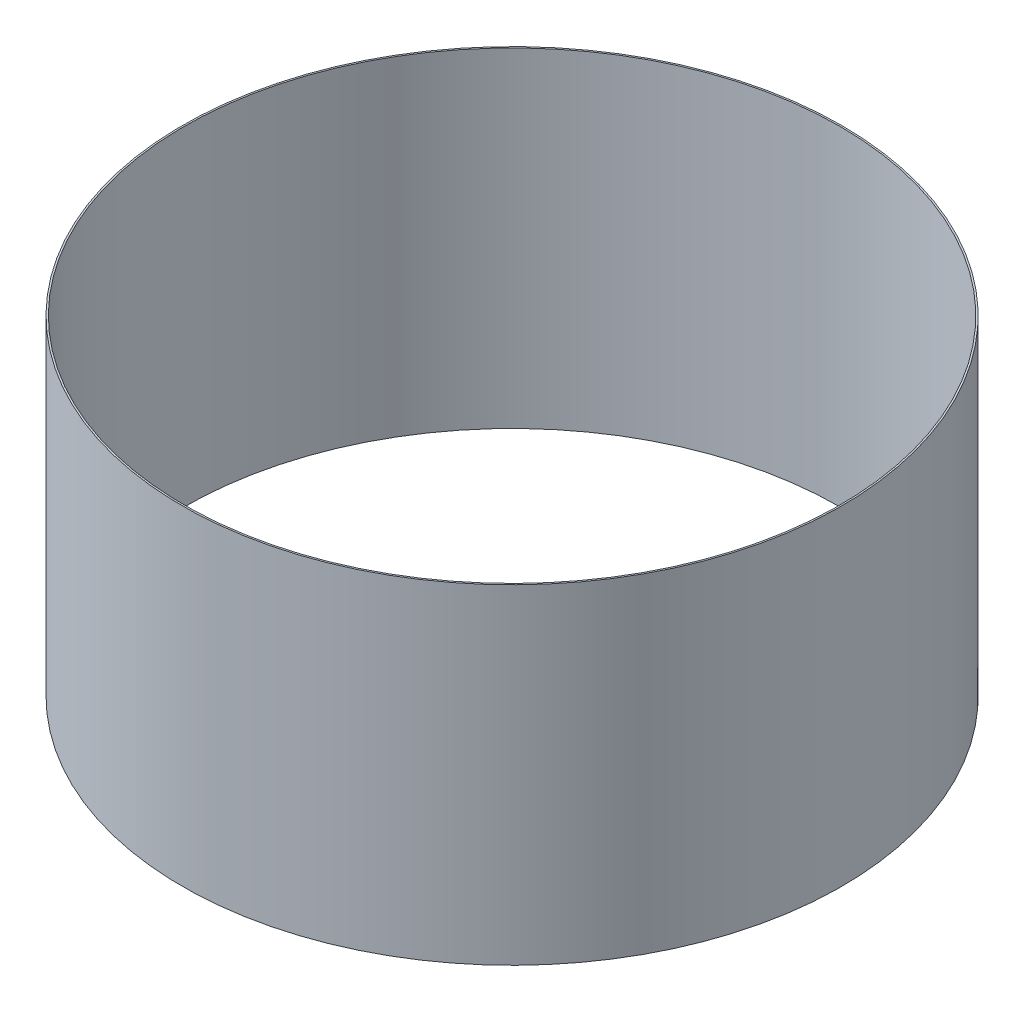
from build123d import *

# Parameters (mm, degrees)
BASE_FLANGE1_DEPTH                    = 200
BASE_FLANGE2_START                    = -1.5
BASE_FLANGE2_DEPTH                    = 1.5
SKETCH9_W                             = 6.25
SKETCH9_H                             = 1.5
F_12_5_12_5_DIAMETER_HOLE2_AT_2_COUNT = 2
F_12_5_12_5_DIAMETER_HOLE2_AT_2_PITCH = 250
F_12_5_12_5_DIAMETER_HOLE2_AT_3_COUNT = 2
F_12_5_12_5_DIAMETER_HOLE2_AT_3_PITCH = 125
F_12_5_12_5_DIAMETER_HOLE2_AT_4_COUNT = 2
F_12_5_12_5_DIAMETER_HOLE2_AT_4_PITCH = 465.111814513
F_12_5_12_5_DIAMETER_HOLE2_AT_5_COUNT = 2
F_12_5_12_5_DIAMETER_HOLE2_AT_5_PITCH = 513.034111926
F_12_5_12_5_DIAMETER_HOLE2_AT_6_COUNT = 2
F_12_5_12_5_DIAMETER_HOLE2_AT_6_PITCH = 448
SKETCH11_W                            = 6.25
SKETCH11_H                            = 1.5
F_12_5_12_5_DIAMETER_HOLE3_AT_2_COUNT = 2
F_12_5_12_5_DIAMETER_HOLE3_AT_2_PITCH = 332
CRVPATTERN1_COUNT                     = 4
CRVPATTERN1_PITCH                     = 125
CRVPATTERN1_COPY_1_SKETCH_W           = 6.25
CRVPATTERN1_COPY_1_SKETCH_H           = 1.5
CRVPATTERN1_COPY_2_SKETCH_W           = 6.25
CRVPATTERN1_COPY_2_SKETCH_H           = 1.5
CRVPATTERN1_COPY_3_SKETCH_W           = 6.25
CRVPATTERN1_COPY_3_SKETCH_H           = 1.5
BASE_FLANGE3_DEPTH                    = 1.5
SKETCH14_W                            = 80
SKETCH14_H                            = 6
SKETCH14_W_2                          = 50
EXTRUDE1_DEPTH                        = 10
CRVPATTERN2_START                     = -81.5
CRVPATTERN2_OUTLINE_W                 = 1.5
CRVPATTERN2_OUTLINE_H                 = 6
CRVPATTERN2_DEPTH                     = 80
CRVPATTERN2_START_2                   = -134.5
CRVPATTERN2_2_OUTLINE_W               = 1.5
CRVPATTERN2_2_OUTLINE_H               = 6
CRVPATTERN2_2_DEPTH                   = 50
SKETCH15_W                            = 6
SKETCH15_H                            = 80
SKETCH15_H_2                          = 50
SKETCH15_H_3                          = 30
SKETCH15_W_2                          = 10
SKETCH15_H_4                          = 10
EXTRUDE2_DEPTH                        = 10


# Read off the part's stored shape, not the designer's step: CrvPattern2
# Sheet-metal steps are written as plain solids
with BuildPart() as part:
    # Sketch1 → Base-Flange1 (new body)
    with BuildSketch(Plane(origin=(0, 0, 0), x_dir=(1, 0, 0), z_dir=(0, 1, 0))):
        with BuildLine():
            ThreePointArc((-0.005, 198.999999937), (0, -199), (0.005, 198.999999937))
            Line((0.005, 198.999999937), (0.005025126, 199.999999937))
            ThreePointArc((0.005025126, 199.999999937), (0, -200), (-0.005025126, 199.999999937))
            Line((-0.005025126, 199.999999937), (-0.005, 198.999999937))
        make_face()
    extrude(amount=BASE_FLANGE1_DEPTH)


with BuildPart() as body_2:
    # Sketch4 → Base-Flange2 (new body)
    with BuildSketch(Plane(origin=(0, 0, 0), x_dir=(1, 0, 0), z_dir=(0, 1, 0)).offset(BASE_FLANGE2_START)):
        Polygon((240, 180), (240, -180), (0, -220), (-240, -180), (-240, 180), (0, 220), align=None)
        with BuildLine():
            Line((143.038535018, 140), (-142.828568571, 140))
            ThreePointArc((-142.828568571, 140), (-200, 0), (-142.828568571, -140))
            Line((-142.828568571, -140), (143.038535018, -140))
            ThreePointArc((143.038535018, -140), (200.15, 0), (143.038535018, 140))
        make_face(mode=Mode.SUBTRACT)
    extrude(amount=BASE_FLANGE2_DEPTH)

    # Sketch9 → Ø12.5 (12.5) Diameter Hole2 (revolve, cut)
    with BuildSketch(Plane(origin=(-224, 0, -125), x_dir=(0, 0, 1), z_dir=(1, 0, 0))):
        with Locations((3.125, 0.75)):
            Rectangle(SKETCH9_W, SKETCH9_H)
    f_12_5_12_5_diameter_hole2 = revolve(axis=Axis((-224, 6.35, -125), (0, -1, 0)), mode=Mode.SUBTRACT)

    # Ø12.5 (12.5) Diameter Hole2 at 2: Ø12.5 (12.5) Diameter Hole2 ×2
    with Locations(*[(0, 0, i * F_12_5_12_5_DIAMETER_HOLE2_AT_2_PITCH) for i in range(1, F_12_5_12_5_DIAMETER_HOLE2_AT_2_COUNT)]):
        add(f_12_5_12_5_diameter_hole2, mode=Mode.SUBTRACT)

    # Ø12.5 (12.5) Diameter Hole2 at 3: Ø12.5 (12.5) Diameter Hole2 ×2
    with Locations(*[(0, 0, i * F_12_5_12_5_DIAMETER_HOLE2_AT_3_PITCH) for i in range(1, F_12_5_12_5_DIAMETER_HOLE2_AT_3_COUNT)]):
        add(f_12_5_12_5_diameter_hole2, mode=Mode.SUBTRACT)

    # Ø12.5 (12.5) Diameter Hole2 at 4: Ø12.5 (12.5) Diameter Hole2 ×2
    with Locations(*[Vector(0.9632092456491202, 0, 0.2687525797012055) * (i * F_12_5_12_5_DIAMETER_HOLE2_AT_4_PITCH) for i in range(1, F_12_5_12_5_DIAMETER_HOLE2_AT_4_COUNT)]):
        add(f_12_5_12_5_diameter_hole2, mode=Mode.SUBTRACT)

    # Ø12.5 (12.5) Diameter Hole2 at 5: Ø12.5 (12.5) Diameter Hole2 ×2
    with Locations(*[Vector(0.8732362811468641, 0, 0.4872970318899912) * (i * F_12_5_12_5_DIAMETER_HOLE2_AT_5_PITCH) for i in range(1, F_12_5_12_5_DIAMETER_HOLE2_AT_5_COUNT)]):
        add(f_12_5_12_5_diameter_hole2, mode=Mode.SUBTRACT)

    # Ø12.5 (12.5) Diameter Hole2 at 6: Ø12.5 (12.5) Diameter Hole2 ×2
    with Locations(*[(i * F_12_5_12_5_DIAMETER_HOLE2_AT_6_PITCH, 0, 0) for i in range(1, F_12_5_12_5_DIAMETER_HOLE2_AT_6_COUNT)]):
        add(f_12_5_12_5_diameter_hole2, mode=Mode.SUBTRACT)

    # Sketch11 → Ø12.5 (12.5) Diameter Hole3 (revolve, cut)
    with BuildSketch(Plane(origin=(-187.5, 0, -166), x_dir=(0, 0, 1), z_dir=(1, 0, 0))):
        with Locations((3.125, 0.75)):
            Rectangle(SKETCH11_W, SKETCH11_H)
    f_12_5_12_5_diameter_hole3 = revolve(axis=Axis((-187.5, 6.35, -166), (0, -1, 0)), mode=Mode.SUBTRACT)

    # Ø12.5 (12.5) Diameter Hole3 at 2: Ø12.5 (12.5) Diameter Hole3 ×2
    with Locations(*[(0, 0, i * F_12_5_12_5_DIAMETER_HOLE3_AT_2_PITCH) for i in range(1, F_12_5_12_5_DIAMETER_HOLE3_AT_2_COUNT)]):
        add(f_12_5_12_5_diameter_hole3, mode=Mode.SUBTRACT)

    # CrvPattern1: Ø12.5 (12.5) Diameter Hole3 ×4
    with Locations(*[(i * CRVPATTERN1_PITCH, 0, 0) for i in range(1, CRVPATTERN1_COUNT)]):
        add(f_12_5_12_5_diameter_hole3, mode=Mode.SUBTRACT)

    # CrvPattern1 copy 1 sketch → CrvPattern1 copy 1 (revolve, cut)
    with BuildSketch(Plane(origin=(-62.5, 0, 166), x_dir=(0, 0, 1), z_dir=(1, 0, 0))):
        with Locations((3.125, 0.75)):
            Rectangle(CRVPATTERN1_COPY_1_SKETCH_W, CRVPATTERN1_COPY_1_SKETCH_H)
    revolve(axis=Axis((-62.5, 6.35, 166), (0, -1, 0)), mode=Mode.SUBTRACT)

    # CrvPattern1 copy 2 sketch → CrvPattern1 copy 2 (revolve, cut)
    with BuildSketch(Plane(origin=(62.5, 0, 166), x_dir=(0, 0, 1), z_dir=(1, 0, 0))):
        with Locations((3.125, 0.75)):
            Rectangle(CRVPATTERN1_COPY_2_SKETCH_W, CRVPATTERN1_COPY_2_SKETCH_H)
    revolve(axis=Axis((62.5, 6.35, 166), (0, -1, 0)), mode=Mode.SUBTRACT)

    # CrvPattern1 copy 3 sketch → CrvPattern1 copy 3 (revolve, cut)
    with BuildSketch(Plane(origin=(187.5, 0, 166), x_dir=(0, 0, 1), z_dir=(1, 0, 0))):
        with Locations((3.125, 0.75)):
            Rectangle(CRVPATTERN1_COPY_3_SKETCH_W, CRVPATTERN1_COPY_3_SKETCH_H)
    revolve(axis=Axis((187.5, 6.35, 166), (0, -1, 0)), mode=Mode.SUBTRACT)

    # Sketch13 → Base-Flange3 (add)
    with BuildSketch(Plane.XZ.offset(1.5)):
        with BuildLine():
            Line((-142.828568571, -140), (143.038535018, -140))
            ThreePointArc((143.038535018, -140), (200.15, 0), (143.038535018, 140))
            Line((143.038535018, 140), (-142.828568571, 140))
            ThreePointArc((-142.828568571, 140), (-200, 0), (-142.828568571, -140))
        make_face()
    extrude(amount=-BASE_FLANGE3_DEPTH)

    # Sketch14 → Extrude1 (cut)
    with BuildSketch(Plane(origin=(0, 0, 0), x_dir=(1, 0, 0), z_dir=(0, 1, 0))):
        with Locations((-41.5, 137)):
            Rectangle(SKETCH14_W, SKETCH14_H)
        with Locations((-109.5, 137)):
            Rectangle(SKETCH14_W_2, SKETCH14_H)
    extrude1 = extrude(amount=-EXTRUDE1_DEPTH, mode=Mode.SUBTRACT)

    # CrvPattern2 outline → CrvPattern2 (cut)
    with BuildSketch(Plane.YZ.offset(CRVPATTERN2_START)):
        with Locations((-0.75, -127.866666667)):
            Rectangle(CRVPATTERN2_OUTLINE_W, CRVPATTERN2_OUTLINE_H)
        with Locations((-0.75, -118.733333333)):
            Rectangle(CRVPATTERN2_OUTLINE_W, CRVPATTERN2_OUTLINE_H)
        with Locations((-0.75, -109.6)):
            Rectangle(CRVPATTERN2_OUTLINE_W, CRVPATTERN2_OUTLINE_H)
        with Locations((-0.75, -100.466666667)):
            Rectangle(CRVPATTERN2_OUTLINE_W, CRVPATTERN2_OUTLINE_H)
        with Locations((-0.75, -91.333333333)):
            Rectangle(CRVPATTERN2_OUTLINE_W, CRVPATTERN2_OUTLINE_H)
        with Locations((-0.75, -82.2)):
            Rectangle(CRVPATTERN2_OUTLINE_W, CRVPATTERN2_OUTLINE_H)
        with Locations((-0.75, -73.066666667)):
            Rectangle(CRVPATTERN2_OUTLINE_W, CRVPATTERN2_OUTLINE_H)
        with Locations((-0.75, -63.933333333)):
            Rectangle(CRVPATTERN2_OUTLINE_W, CRVPATTERN2_OUTLINE_H)
        with Locations((-0.75, -54.8)):
            Rectangle(CRVPATTERN2_OUTLINE_W, CRVPATTERN2_OUTLINE_H)
        with Locations((-0.75, -45.666666667)):
            Rectangle(CRVPATTERN2_OUTLINE_W, CRVPATTERN2_OUTLINE_H)
        with Locations((-0.75, -36.533333333)):
            Rectangle(CRVPATTERN2_OUTLINE_W, CRVPATTERN2_OUTLINE_H)
        with Locations((-0.75, -27.4)):
            Rectangle(CRVPATTERN2_OUTLINE_W, CRVPATTERN2_OUTLINE_H)
        with Locations((-0.75, -18.266666667)):
            Rectangle(CRVPATTERN2_OUTLINE_W, CRVPATTERN2_OUTLINE_H)
        with Locations((-0.75, -9.133333333)):
            Rectangle(CRVPATTERN2_OUTLINE_W, CRVPATTERN2_OUTLINE_H)
        with Locations((-0.75, 0)):
            Rectangle(CRVPATTERN2_OUTLINE_W, CRVPATTERN2_OUTLINE_H)
        with Locations((-0.75, 9.133333333)):
            Rectangle(CRVPATTERN2_OUTLINE_W, CRVPATTERN2_OUTLINE_H)
        with Locations((-0.75, 18.266666667)):
            Rectangle(CRVPATTERN2_OUTLINE_W, CRVPATTERN2_OUTLINE_H)
        with Locations((-0.75, 27.4)):
            Rectangle(CRVPATTERN2_OUTLINE_W, CRVPATTERN2_OUTLINE_H)
        with Locations((-0.75, 36.533333333)):
            Rectangle(CRVPATTERN2_OUTLINE_W, CRVPATTERN2_OUTLINE_H)
        with Locations((-0.75, 45.666666667)):
            Rectangle(CRVPATTERN2_OUTLINE_W, CRVPATTERN2_OUTLINE_H)
        with Locations((-0.75, 54.8)):
            Rectangle(CRVPATTERN2_OUTLINE_W, CRVPATTERN2_OUTLINE_H)
        with Locations((-0.75, 63.933333333)):
            Rectangle(CRVPATTERN2_OUTLINE_W, CRVPATTERN2_OUTLINE_H)
        with Locations((-0.75, 73.066666667)):
            Rectangle(CRVPATTERN2_OUTLINE_W, CRVPATTERN2_OUTLINE_H)
        with Locations((-0.75, 82.2)):
            Rectangle(CRVPATTERN2_OUTLINE_W, CRVPATTERN2_OUTLINE_H)
        with Locations((-0.75, 91.333333333)):
            Rectangle(CRVPATTERN2_OUTLINE_W, CRVPATTERN2_OUTLINE_H)
        with Locations((-0.75, 100.466666667)):
            Rectangle(CRVPATTERN2_OUTLINE_W, CRVPATTERN2_OUTLINE_H)
        with Locations((-0.75, 109.6)):
            Rectangle(CRVPATTERN2_OUTLINE_W, CRVPATTERN2_OUTLINE_H)
        with Locations((-0.75, 118.733333333)):
            Rectangle(CRVPATTERN2_OUTLINE_W, CRVPATTERN2_OUTLINE_H)
        with Locations((-0.75, 127.866666667)):
            Rectangle(CRVPATTERN2_OUTLINE_W, CRVPATTERN2_OUTLINE_H)
        with Locations((-0.75, 137)):
            Rectangle(CRVPATTERN2_OUTLINE_W, CRVPATTERN2_OUTLINE_H)
    crvpattern2 = extrude(amount=CRVPATTERN2_DEPTH, mode=Mode.SUBTRACT)

    # CrvPattern2 2 outline → CrvPattern2 2 (cut)
    with BuildSketch(Plane.YZ.offset(CRVPATTERN2_START_2)):
        with Locations((-0.75, -127.866666667)):
            Rectangle(CRVPATTERN2_2_OUTLINE_W, CRVPATTERN2_2_OUTLINE_H)
        with Locations((-0.75, -118.733333333)):
            Rectangle(CRVPATTERN2_2_OUTLINE_W, CRVPATTERN2_2_OUTLINE_H)
        with Locations((-0.75, -109.6)):
            Rectangle(CRVPATTERN2_2_OUTLINE_W, CRVPATTERN2_2_OUTLINE_H)
        with Locations((-0.75, -100.466666667)):
            Rectangle(CRVPATTERN2_2_OUTLINE_W, CRVPATTERN2_2_OUTLINE_H)
        with Locations((-0.75, -91.333333333)):
            Rectangle(CRVPATTERN2_2_OUTLINE_W, CRVPATTERN2_2_OUTLINE_H)
        with Locations((-0.75, -82.2)):
            Rectangle(CRVPATTERN2_2_OUTLINE_W, CRVPATTERN2_2_OUTLINE_H)
        with Locations((-0.75, -73.066666667)):
            Rectangle(CRVPATTERN2_2_OUTLINE_W, CRVPATTERN2_2_OUTLINE_H)
        with Locations((-0.75, -63.933333333)):
            Rectangle(CRVPATTERN2_2_OUTLINE_W, CRVPATTERN2_2_OUTLINE_H)
        with Locations((-0.75, -54.8)):
            Rectangle(CRVPATTERN2_2_OUTLINE_W, CRVPATTERN2_2_OUTLINE_H)
        with Locations((-0.75, -45.666666667)):
            Rectangle(CRVPATTERN2_2_OUTLINE_W, CRVPATTERN2_2_OUTLINE_H)
        with Locations((-0.75, -36.533333333)):
            Rectangle(CRVPATTERN2_2_OUTLINE_W, CRVPATTERN2_2_OUTLINE_H)
        with Locations((-0.75, -27.4)):
            Rectangle(CRVPATTERN2_2_OUTLINE_W, CRVPATTERN2_2_OUTLINE_H)
        with Locations((-0.75, -18.266666667)):
            Rectangle(CRVPATTERN2_2_OUTLINE_W, CRVPATTERN2_2_OUTLINE_H)
        with Locations((-0.75, -9.133333333)):
            Rectangle(CRVPATTERN2_2_OUTLINE_W, CRVPATTERN2_2_OUTLINE_H)
        with Locations((-0.75, 0)):
            Rectangle(CRVPATTERN2_2_OUTLINE_W, CRVPATTERN2_2_OUTLINE_H)
        with Locations((-0.75, 9.133333333)):
            Rectangle(CRVPATTERN2_2_OUTLINE_W, CRVPATTERN2_2_OUTLINE_H)
        with Locations((-0.75, 18.266666667)):
            Rectangle(CRVPATTERN2_2_OUTLINE_W, CRVPATTERN2_2_OUTLINE_H)
        with Locations((-0.75, 27.4)):
            Rectangle(CRVPATTERN2_2_OUTLINE_W, CRVPATTERN2_2_OUTLINE_H)
        with Locations((-0.75, 36.533333333)):
            Rectangle(CRVPATTERN2_2_OUTLINE_W, CRVPATTERN2_2_OUTLINE_H)
        with Locations((-0.75, 45.666666667)):
            Rectangle(CRVPATTERN2_2_OUTLINE_W, CRVPATTERN2_2_OUTLINE_H)
        with Locations((-0.75, 54.8)):
            Rectangle(CRVPATTERN2_2_OUTLINE_W, CRVPATTERN2_2_OUTLINE_H)
        with Locations((-0.75, 63.933333333)):
            Rectangle(CRVPATTERN2_2_OUTLINE_W, CRVPATTERN2_2_OUTLINE_H)
        with Locations((-0.75, 73.066666667)):
            Rectangle(CRVPATTERN2_2_OUTLINE_W, CRVPATTERN2_2_OUTLINE_H)
        with Locations((-0.75, 82.2)):
            Rectangle(CRVPATTERN2_2_OUTLINE_W, CRVPATTERN2_2_OUTLINE_H)
        with Locations((-0.75, 91.333333333)):
            Rectangle(CRVPATTERN2_2_OUTLINE_W, CRVPATTERN2_2_OUTLINE_H)
        with Locations((-0.75, 100.466666667)):
            Rectangle(CRVPATTERN2_2_OUTLINE_W, CRVPATTERN2_2_OUTLINE_H)
        with Locations((-0.75, 109.6)):
            Rectangle(CRVPATTERN2_2_OUTLINE_W, CRVPATTERN2_2_OUTLINE_H)
        with Locations((-0.75, 118.733333333)):
            Rectangle(CRVPATTERN2_2_OUTLINE_W, CRVPATTERN2_2_OUTLINE_H)
        with Locations((-0.75, 127.866666667)):
            Rectangle(CRVPATTERN2_2_OUTLINE_W, CRVPATTERN2_2_OUTLINE_H)
        with Locations((-0.75, 137)):
            Rectangle(CRVPATTERN2_2_OUTLINE_W, CRVPATTERN2_2_OUTLINE_H)
    crvpattern2_2 = extrude(amount=CRVPATTERN2_2_DEPTH, mode=Mode.SUBTRACT)

    # Sketch15 → Extrude2 (cut)
    with BuildSketch(Plane(origin=(0, 0, 0), x_dir=(1, 0, 0), z_dir=(0, 1, 0))):
        with Locations((-140.5, 41.5)):
            Rectangle(SKETCH15_W, SKETCH15_H)
        with Locations((-140.5, 109.5)):
            Rectangle(SKETCH15_W, SKETCH15_H_2)
        with Locations((-149.5, 41.5)):
            Rectangle(SKETCH15_W, SKETCH15_H)
        with Locations((-149.5, 109.5)):
            Rectangle(SKETCH15_W, SKETCH15_H_2)
        with Locations((-158.5, 41.5)):
            Rectangle(SKETCH15_W, SKETCH15_H)
        with Locations((-167.5, 41.5)):
            Rectangle(SKETCH15_W, SKETCH15_H)
        with Locations((-176.5, 41.5)):
            Rectangle(SKETCH15_W, SKETCH15_H)
        with Locations((-185.5, 41.5)):
            Rectangle(SKETCH15_W, SKETCH15_H)
        with Locations((-158.5, 99.5)):
            Rectangle(SKETCH15_W, SKETCH15_H_3)
        with Locations((-169.5, 89.5)):
            Rectangle(SKETCH15_W_2, SKETCH15_H_4)
        with Locations((-169.5, -89.5)):
            Rectangle(SKETCH15_W_2, SKETCH15_H_4)
        with Locations((-158.5, -99.5)):
            Rectangle(SKETCH15_W, SKETCH15_H_3)
        with Locations((-185.5, -41.5)):
            Rectangle(SKETCH15_W, SKETCH15_H)
        with Locations((-176.5, -41.5)):
            Rectangle(SKETCH15_W, SKETCH15_H)
        with Locations((-167.5, -41.5)):
            Rectangle(SKETCH15_W, SKETCH15_H)
        with Locations((-158.5, -41.5)):
            Rectangle(SKETCH15_W, SKETCH15_H)
        with Locations((-149.5, -109.5)):
            Rectangle(SKETCH15_W, SKETCH15_H_2)
        with Locations((-149.5, -41.5)):
            Rectangle(SKETCH15_W, SKETCH15_H)
        with Locations((-140.5, -109.5)):
            Rectangle(SKETCH15_W, SKETCH15_H_2)
        with Locations((-140.5, -41.5)):
            Rectangle(SKETCH15_W, SKETCH15_H)
        with Locations((-194.5, 0)):
            Rectangle(SKETCH15_W, SKETCH15_H)
    extrude2 = extrude(amount=-EXTRUDE2_DEPTH, mode=Mode.SUBTRACT)

    # Mirror1: Extrude1, CrvPattern2, CrvPattern2 2, Extrude2 across plane
    add(extrude1.mirror(Plane(origin=(0, 0, 0), x_dir=(0, 0, 1), z_dir=(1, 0, 0))), mode=Mode.SUBTRACT)
    add(crvpattern2.mirror(Plane(origin=(0, 0, 0), x_dir=(0, 0, 1), z_dir=(1, 0, 0))), mode=Mode.SUBTRACT)
    add(crvpattern2_2.mirror(Plane(origin=(0, 0, 0), x_dir=(0, 0, 1), z_dir=(1, 0, 0))), mode=Mode.SUBTRACT)
    add(extrude2.mirror(Plane(origin=(0, 0, 0), x_dir=(0, 0, 1), z_dir=(1, 0, 0))), mode=Mode.SUBTRACT)


solid = part.part
